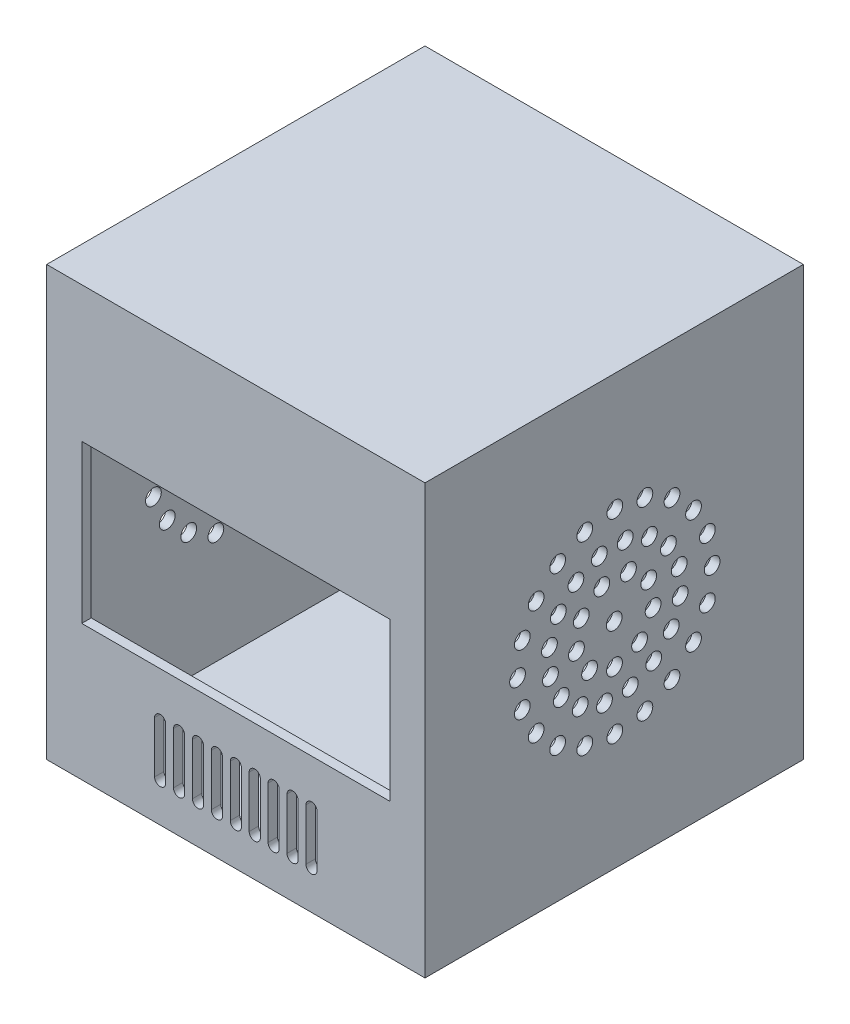
from build123d import *

# Parameters (mm, degrees)
SKETCH1_W           = 120
SKETCH1_H           = 120
SKETCH1_W_2         = 114
SKETCH1_H_2         = 114
BOSS_EXTRUDE1_DEPTH = 130
SKETCH2_W           = 97.733444072
SKETCH2_H           = 50
CUT_EXTRUDE2_DEPTH  = 19
SKETCH3_W           = 120
SKETCH3_H           = 120
BOSS_EXTRUDE3_DEPTH = 3
SKETCH4_W           = 120
SKETCH4_H           = 120
BOSS_EXTRUDE4_DEPTH = 3
SKETCH6_R           = 2.5
CUT_EXTRUDE3_DEPTH  = 189.915324947
CUT_EXTRUDE4_DEPTH  = 32


with BuildPart() as part:
    # Sketch1 → Boss-Extrude1 (new body)
    with BuildSketch(Plane(origin=(0, 0, 0), x_dir=(1, 0, 0), z_dir=(0, 1, 0))):
        Rectangle(SKETCH1_W, SKETCH1_H)
        Rectangle(SKETCH1_W_2, SKETCH1_H_2, mode=Mode.SUBTRACT)
    extrude(amount=BOSS_EXTRUDE1_DEPTH)

    # Sketch2 → Cut-Extrude2 (cut)
    with BuildSketch(Plane.XY.offset(60)):
        with Locations((0, 64.970703347)):
            Rectangle(SKETCH2_W, SKETCH2_H)
    extrude(amount=-CUT_EXTRUDE2_DEPTH, mode=Mode.SUBTRACT)

    # Sketch3 → Boss-Extrude3 (add)
    with BuildSketch(Plane.XZ):
        Rectangle(SKETCH3_W, SKETCH3_H)
    extrude(amount=BOSS_EXTRUDE3_DEPTH)

    # Sketch4 → Boss-Extrude4 (add)
    with BuildSketch(Plane(origin=(0, 130, 0), x_dir=(1, 0, 0), z_dir=(0, 1, 0))):
        Rectangle(SKETCH4_W, SKETCH4_H)
    extrude(amount=BOSS_EXTRUDE4_DEPTH)

    # Sketch6 → Cut-Extrude3 (cut, through all)
    with BuildSketch(Plane(origin=(60, 0, 0), x_dir=(0, 0, -1), z_dir=(1, 0, 0))):
        with Locations((0, 65)):
            Circle(SKETCH6_R)
        with Locations((0.208526799, 95.64247955)):
            Circle(SKETCH6_R)
        with Locations((9.743871646, 94.132229293)):
            Circle(SKETCH6_R)
        with Locations((18.345830503, 89.74931234)):
            Circle(SKETCH6_R)
        with Locations((25.172383704, 82.92275914)):
            Circle(SKETCH6_R)
        with Locations((29.555300657, 74.320800283)):
            Circle(SKETCH6_R)
        with Locations((31.065550914, 64.785455436)):
            Circle(SKETCH6_R)
        with Locations((29.555300657, 55.250110588)):
            Circle(SKETCH6_R)
        with Locations((25.172383704, 46.648151732)):
            Circle(SKETCH6_R)
        with Locations((18.345830503, 39.821598531)):
            Circle(SKETCH6_R)
        with Locations((9.743871646, 35.438681578)):
            Circle(SKETCH6_R)
        with Locations((0.208526799, 33.928431321)):
            Circle(SKETCH6_R)
        with Locations((-9.326818048, 35.438681578)):
            Circle(SKETCH6_R)
        with Locations((-17.928776905, 39.821598531)):
            Circle(SKETCH6_R)
        with Locations((-24.755330105, 46.648151732)):
            Circle(SKETCH6_R)
        with Locations((-29.138247058, 55.250110588)):
            Circle(SKETCH6_R)
        with Locations((-30.648497315, 64.785455436)):
            Circle(SKETCH6_R)
        with Locations((-29.138247058, 74.320800283)):
            Circle(SKETCH6_R)
        with Locations((-24.755330105, 82.92275914)):
            Circle(SKETCH6_R)
        with Locations((-17.928776905, 89.74931234)):
            Circle(SKETCH6_R)
        with Locations((-9.326818048, 94.132229293)):
            Circle(SKETCH6_R)
        with Locations((3.493650565, 85.526910588)):
            Circle(SKETCH6_R)
        with Locations((11.180996658, 82.690898887)):
            Circle(SKETCH6_R)
        with Locations((17.197883681, 77.128945734)):
            Circle(SKETCH6_R)
        with Locations((20.628295128, 69.687808077)):
            Circle(SKETCH6_R)
        with Locations((20.949981952, 61.50033167)):
            Circle(SKETCH6_R)
        with Locations((18.113970251, 53.812985577)):
            Circle(SKETCH6_R)
        with Locations((12.552017097, 47.796098554)):
            Circle(SKETCH6_R)
        with Locations((5.11087944, 44.365687107)):
            Circle(SKETCH6_R)
        with Locations((-3.076596967, 44.044000283)):
            Circle(SKETCH6_R)
        with Locations((-10.76394306, 46.880011984)):
            Circle(SKETCH6_R)
        with Locations((-16.780830083, 52.441965138)):
            Circle(SKETCH6_R)
        with Locations((-20.211241529, 59.883102795)):
            Circle(SKETCH6_R)
        with Locations((-20.532928353, 68.070579202)):
            Circle(SKETCH6_R)
        with Locations((-17.696916652, 75.757925295)):
            Circle(SKETCH6_R)
        with Locations((-12.134963499, 81.774812318)):
            Circle(SKETCH6_R)
        with Locations((-4.693825842, 85.205223764)):
            Circle(SKETCH6_R)
        with Locations((4.528528716, 76.348298346)):
            Circle(SKETCH6_R)
        with Locations((10.950292418, 70.866263288)):
            Circle(SKETCH6_R)
        with Locations((12.345864605, 62.538950655)):
            Circle(SKETCH6_R)
        with Locations((8.062241542, 55.262802576)):
            Circle(SKETCH6_R)
        with Locations((0.103778066, 52.442409602)):
            Circle(SKETCH6_R)
        with Locations((-7.805672313, 55.397464952)):
            Circle(SKETCH6_R)
        with Locations((-11.96518986, 62.745265385)):
            Circle(SKETCH6_R)
        with Locations((-10.428490086, 71.047693416)):
            Circle(SKETCH6_R)
        with Locations((-3.914611894, 76.4199507)):
            Circle(SKETCH6_R)
    extrude(amount=-CUT_EXTRUDE3_DEPTH, mode=Mode.SUBTRACT)

    # Sketch7 → Cut-Extrude4 (cut)
    with BuildSketch(Plane.XY.offset(60)):
        with BuildLine():
            Line((1.767099932, 25.648161373), (1.767099932, 9.351573112))
            ThreePointArc((1.767099932, 9.351573112), (0, 7.584473181), (-1.767099932, 9.351573112))
            Line((-1.767099932, 9.351573112), (-1.767099932, 25.648161373))
            ThreePointArc((-1.767099932, 25.648161373), (0, 27.415261305), (1.767099932, 25.648161373))
        make_face()
        with BuildLine():
            Line((7.767099932, 25.648161373), (7.767099932, 9.351573112))
            ThreePointArc((7.767099932, 9.351573112), (6, 7.584473181), (4.232900068, 9.351573112))
            Line((4.232900068, 9.351573112), (4.232900068, 25.648161373))
            ThreePointArc((4.232900068, 25.648161373), (6, 27.415261305), (7.767099932, 25.648161373))
        make_face()
        with BuildLine():
            Line((13.767099932, 25.648161373), (13.767099932, 9.351573112))
            ThreePointArc((13.767099932, 9.351573112), (12, 7.584473181), (10.232900068, 9.351573112))
            Line((10.232900068, 9.351573112), (10.232900068, 25.648161373))
            ThreePointArc((10.232900068, 25.648161373), (12, 27.415261305), (13.767099932, 25.648161373))
        make_face()
        with BuildLine():
            Line((19.767099932, 25.648161373), (19.767099932, 9.351573112))
            ThreePointArc((19.767099932, 9.351573112), (18, 7.584473181), (16.232900068, 9.351573112))
            Line((16.232900068, 9.351573112), (16.232900068, 25.648161373))
            ThreePointArc((16.232900068, 25.648161373), (18, 27.415261305), (19.767099932, 25.648161373))
        make_face()
        with BuildLine():
            Line((25.767099932, 25.648161373), (25.767099932, 9.351573112))
            ThreePointArc((25.767099932, 9.351573112), (24, 7.584473181), (22.232900068, 9.351573112))
            Line((22.232900068, 9.351573112), (22.232900068, 25.648161373))
            ThreePointArc((22.232900068, 25.648161373), (24, 27.415261305), (25.767099932, 25.648161373))
        make_face()
        with BuildLine():
            Line((-4.232900068, 25.648161373), (-4.232900068, 9.351573112))
            ThreePointArc((-4.232900068, 9.351573112), (-6, 7.584473181), (-7.767099932, 9.351573112))
            Line((-7.767099932, 9.351573112), (-7.767099932, 25.648161373))
            ThreePointArc((-7.767099932, 25.648161373), (-6, 27.415261305), (-4.232900068, 25.648161373))
        make_face()
        with BuildLine():
            Line((-10.232900068, 25.648161373), (-10.232900068, 9.351573112))
            ThreePointArc((-10.232900068, 9.351573112), (-12, 7.584473181), (-13.767099932, 9.351573112))
            Line((-13.767099932, 9.351573112), (-13.767099932, 25.648161373))
            ThreePointArc((-13.767099932, 25.648161373), (-12, 27.415261305), (-10.232900068, 25.648161373))
        make_face()
        with BuildLine():
            Line((-16.232900068, 25.648161373), (-16.232900068, 9.351573112))
            ThreePointArc((-16.232900068, 9.351573112), (-18, 7.584473181), (-19.767099932, 9.351573112))
            Line((-19.767099932, 9.351573112), (-19.767099932, 25.648161373))
            ThreePointArc((-19.767099932, 25.648161373), (-18, 27.415261305), (-16.232900068, 25.648161373))
        make_face()
        with BuildLine():
            Line((-22.232900068, 25.648161373), (-22.232900068, 9.351573112))
            ThreePointArc((-22.232900068, 9.351573112), (-24, 7.584473181), (-25.767099932, 9.351573112))
            Line((-25.767099932, 9.351573112), (-25.767099932, 25.648161373))
            ThreePointArc((-25.767099932, 25.648161373), (-24, 27.415261305), (-22.232900068, 25.648161373))
        make_face()
    extrude(amount=-CUT_EXTRUDE4_DEPTH, mode=Mode.SUBTRACT)


solid = part.part
